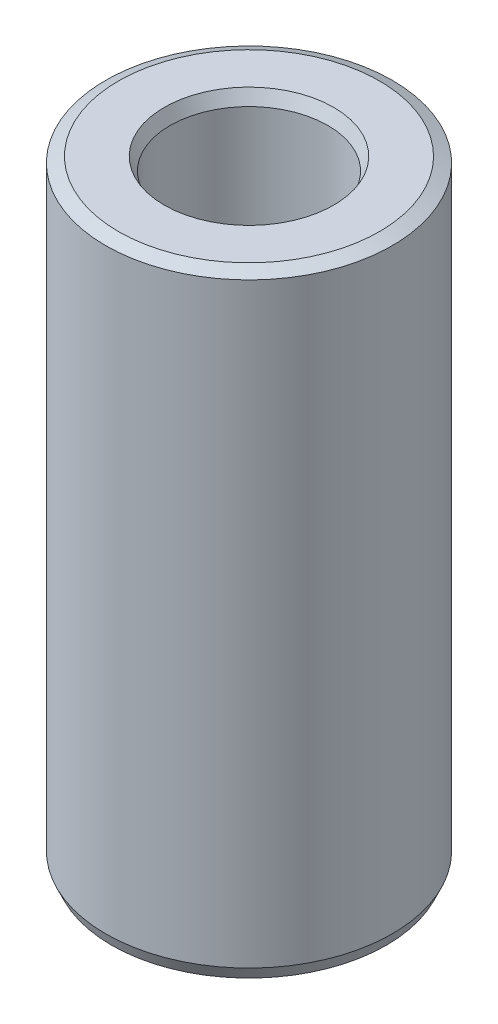
from build123d import *
from OCP.BRepFilletAPI import BRepFilletAPI_MakeChamfer

# Parameters (mm, degrees)
SKETCH1_R           = 32.5
BOSS_EXTRUDE1_DEPTH = 139.398685957
SKETCH2_R           = 17.902337781
CUT_EXTRUDE1_DEPTH  = 147.780426646
CHAMFER1_SIZE       = 1.316565783
CHAMFER1_SIZE2      = 2.898539706


with BuildPart() as part:
    # Sketch1 → Boss-Extrude1 (new body)
    with BuildSketch(Plane(origin=(0, 0, 0), x_dir=(1, 0, 0), z_dir=(0, 1, 0))):
        Circle(SKETCH1_R)
    extrude(amount=BOSS_EXTRUDE1_DEPTH)

    # Sketch2 → Cut-Extrude1 (cut, through all)
    with BuildSketch(Plane(origin=(0, 0, 0), x_dir=(1, 0, 0), z_dir=(0, 1, 0))):
        Circle(SKETCH2_R)
    extrude(amount=CUT_EXTRUDE1_DEPTH, mode=Mode.SUBTRACT)

    # Chamfer1: one chamfer whose edges measure the first distance from different faces: ONE call of the kernel's chamfer builder (chamfer() names one face for all edges)
    chamfer1_edges_1 = [part.edges().sort_by_distance(p)[0] for p in [
        (-17.902337781, 139.398685957, 0),
    ]]
    chamfer1_side_1 = [part.faces().sort_by_distance(p)[0] for p in [
        (-31.580761184, 139.398685957, 0),
    ]]
    chamfer1_edges_2 = [part.edges().sort_by_distance(p)[0] for p in [
        (-17.902337781, 0, 0),
    ]]
    chamfer1_side_2 = [part.faces().sort_by_distance(p)[0] for p in [
        (-17.902337781, 69.699342978, 0),
    ]]
    chamfer1_edges_3 = [part.edges().sort_by_distance(p)[0] for p in [
        (-32.5, 0, 0),
    ]]
    chamfer1_side_3 = [part.faces().sort_by_distance(p)[0] for p in [
        (-31.580761184, 0, 0),
    ]]
    chamfer1_edges_4 = [part.edges().sort_by_distance(p)[0] for p in [
        (-32.5, 139.398685957, 0),
    ]]
    chamfer1_side_4 = [part.faces().sort_by_distance(p)[0] for p in [
        (-32.5, 69.699342978, 0),
    ]]
    chamfer1 = BRepFilletAPI_MakeChamfer(part.part.solid().wrapped)
    for e in chamfer1_edges_1:
        chamfer1.Add(CHAMFER1_SIZE, CHAMFER1_SIZE2, e.wrapped, chamfer1_side_1[0].wrapped)  # the first distance lies on this face
    for e in chamfer1_edges_2:
        chamfer1.Add(CHAMFER1_SIZE, CHAMFER1_SIZE2, e.wrapped, chamfer1_side_2[0].wrapped)  # the first distance lies on this face
    for e in chamfer1_edges_3:
        chamfer1.Add(CHAMFER1_SIZE, CHAMFER1_SIZE2, e.wrapped, chamfer1_side_3[0].wrapped)  # the first distance lies on this face
    for e in chamfer1_edges_4:
        chamfer1.Add(CHAMFER1_SIZE, CHAMFER1_SIZE2, e.wrapped, chamfer1_side_4[0].wrapped)  # the first distance lies on this face
    add(Compound.cast(chamfer1.Shape()), mode=Mode.REPLACE)


solid = part.part
